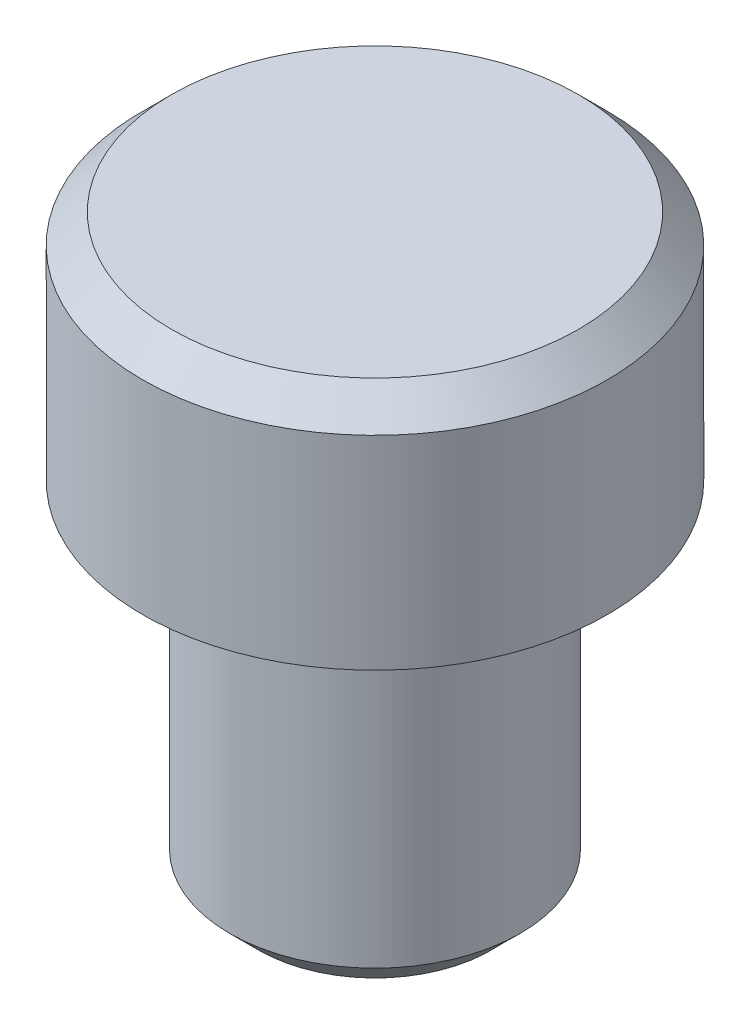
from build123d import *

# Parameters (mm, degrees)
CHAMFER_1_SIZE = 1


with BuildPart() as part:
    # 草图1 → 旋转1 (revolve)
    with BuildSketch(Plane.XY, mode=Mode.PRIVATE) as revolve_1_sk:
        Polygon((0, 0), (8, 0), (8, -8), (4, -8), (4, -9), (5, -9), (5, -20), (0, -20), align=None)
    revolve(revolve_1_sk.sketch.rotate(Axis((0, -20, 0), (0, 1, 0)), 90), axis=Axis((0, -20, 0), (0, 1, 0)))

    # 倒角1
    chamfer_1_edges = [part.edges().sort_by_distance(p)[0] for p in [
        (0, -20, 5),
        (0, -9, 5),
        (0, 0, 8),
    ]]
    chamfer(chamfer_1_edges, length=CHAMFER_1_SIZE - 0.0001)  # a hair under: the kernel refuses the full size


solid = part.part
